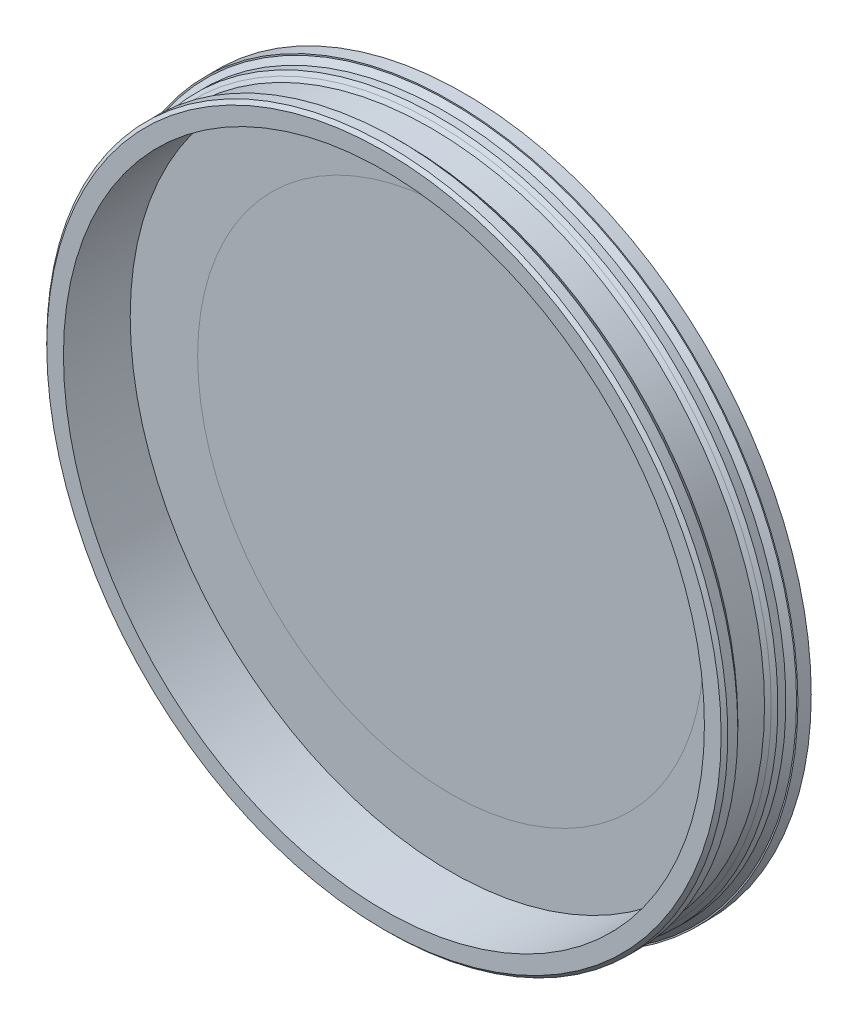
from build123d import *

# Parameters (mm, degrees)
CHAMFER1_SIZE           = 0.5
CHAMFER2_SIZE           = 0.8
CUT_EXTRUDE1_DEPTH      = 76.879443857
CUT_EXTRUDE1_DEPTH_BACK = 76.879443857
SKETCH3_W               = 104.560873996
SKETCH3_H               = 26.139248716
SKETCH4_R               = 37.9
BOSS_EXTRUDE1_DEPTH     = 2


with BuildPart() as part:
    # Sketch1 → Revolve1 (revolve)
    with BuildSketch(Plane(origin=(0, 0, 0), x_dir=(1, 0, 0), z_dir=(0, 1, 0)), mode=Mode.PRIVATE) as revolve1_sk:
        Polygon((37.9, 0), (37.9, -8.7), (48, -8.7), (48, -18.7), (51, -18.7), (51, -16.2), (50, -16.2), (50, -11.2), (51, -11.2), (51, -8.7), (52, -8.7), (52, -6.7), (39.9, -6.7), (39.9, 0), align=None)
    revolve(revolve1_sk.sketch.rotate(Axis((0, 0, -73.981367368), (0, 0, 1)), 180), axis=Axis((0, 0, -73.981367368), (0, 0, 1)))

    # Chamfer1
    chamfer1_edges = [part.edges().sort_by_distance(p)[0] for p in [
        (51, 0, 11.2),
        (50, 0, 11.2),
        (50, 0, 16.2),
        (51, 0, 16.2),
        (51, 0, 18.7),
        (39.9, 0, 0),
    ]]
    chamfer(chamfer1_edges, length=CHAMFER1_SIZE - 0.0001)  # a hair under: the kernel refuses the full size

    # Chamfer2
    chamfer2_edges = [part.edges().sort_by_distance(p)[0] for p in [
        (51, 0, 8.7),
    ]]
    chamfer(chamfer2_edges, length=CHAMFER2_SIZE)

    # Sketch3 → Cut-Extrude1 (cut, two sides: drawn at the far end of the back side and taken through both)
    with BuildSketch(Plane(origin=(0, 0, 0), x_dir=(1, 0, 0), z_dir=(0, 1, 0)).offset(-CUT_EXTRUDE1_DEPTH_BACK)):
        with Locations((3.61950671, 6.369624358)):
            Rectangle(SKETCH3_W, SKETCH3_H)
    extrude(amount=CUT_EXTRUDE1_DEPTH + CUT_EXTRUDE1_DEPTH_BACK, mode=Mode.SUBTRACT)


with BuildPart() as body_2:
    # Sketch4 → Boss-Extrude1 (new body)
    with BuildSketch(Plane(origin=(0, 0, 6.7), x_dir=(-1, 0, 0), z_dir=(0, 0, -1))):
        Circle(SKETCH4_R)
    extrude(amount=-BOSS_EXTRUDE1_DEPTH)


solid = Compound([part.part, body_2.part])
